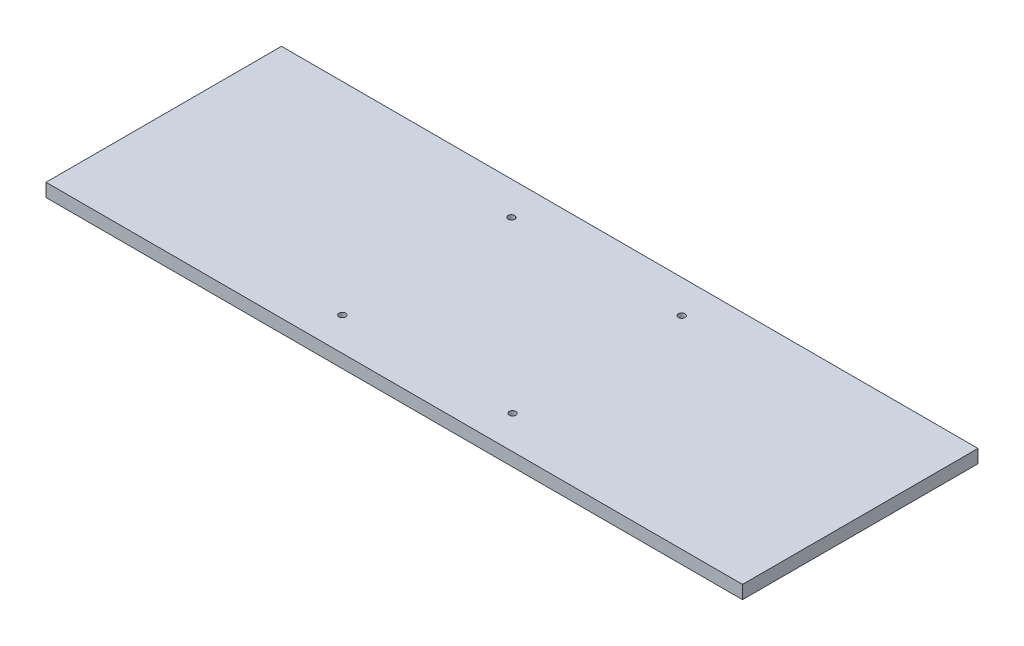
from build123d import *

# Parameters (mm, degrees)
SKETCH1_W           = 420
SKETCH1_H           = 142
SKETCH1_R           = 2
BOSS_EXTRUDE1_DEPTH = 8


with BuildPart() as part:
    # Sketch1 → Boss-Extrude1 (new body)
    with BuildSketch(Plane(origin=(0, 0, 0), x_dir=(1, 0, 0), z_dir=(0, 1, 0))):
        with Locations((210, 71)):
            Rectangle(SKETCH1_W, SKETCH1_H)
        with Locations((158.666666667, 20)):
            Circle(SKETCH1_R, mode=Mode.SUBTRACT)
        with Locations((261.333333333, 20)):
            Circle(SKETCH1_R, mode=Mode.SUBTRACT)
        with Locations((261.333333333, 122)):
            Circle(SKETCH1_R, mode=Mode.SUBTRACT)
        with Locations((158.666666667, 122)):
            Circle(SKETCH1_R, mode=Mode.SUBTRACT)
    extrude(amount=BOSS_EXTRUDE1_DEPTH)


solid = part.part
